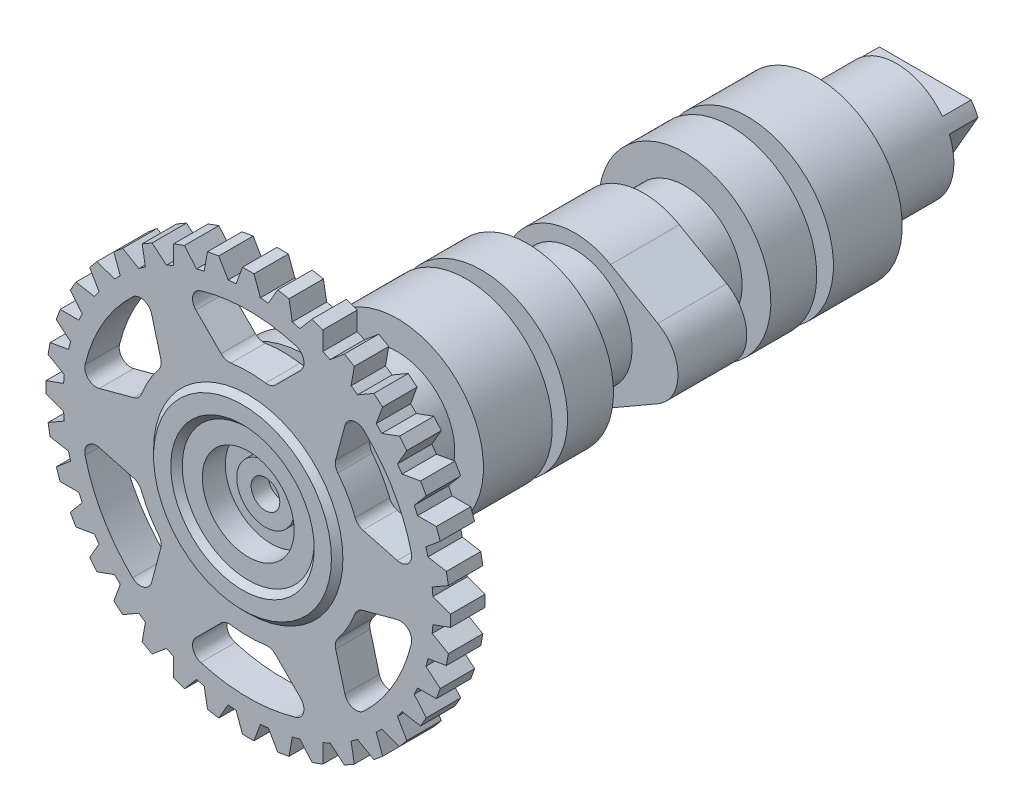
from build123d import *

# Parameters (mm, degrees)
SKETCH1_R               = 10
SHAFT_DEPTH             = 118
SKETCH2_R               = 32.25
GEAR_DEPTH              = 6
BOSS_EXTRUDE3_DEPTH     = 6
SKETCH4_R               = 14
BOSS_EXTRUDE4_DEPTH     = 3
BOSS_EXTRUDE5_START     = 4
SKETCH5_R               = 17.5
BOSS_EXTRUDE5_DEPTH     = 4
CUT_EXTRUDE1_DEPTH      = 129.098106934
CUT_EXTRUDE1_DEPTH_BACK = 5
SKETCH7_R               = 8
CUT_EXTRUDE2_DEPTH      = 3
SKETCH8_R               = 8
SKETCH8_R_2             = 5
CUT_EXTRUDE3_DEPTH      = 1
SKETCH9_R               = 2.5
CUT_EXTRUDE4_DEPTH      = 3
SKETCH10_R              = 15.5
SKETCH10_R_2            = 12.5
BOSS_EXTRUDE6_DEPTH     = 1
CHAMFER1_SIZE           = 1
BOSS_EXTRUDE7_START     = 34.662
BOSS_EXTRUDE7_DEPTH     = 8
BOSS_EXTRUDE8_START     = 70.0933
BOSS_EXTRUDE8_DEPTH     = 8
BOSS_EXTRUDE9_START     = 20
SKETCH13_R              = 15
BOSS_EXTRUDE9_DEPTH     = 12
BOSS_EXTRUDE10_START    = 81
SKETCH14_R              = 15
BOSS_EXTRUDE10_DEPTH    = 12
BOSS_EXTRUDE11_START    = 62.9
BOSS_EXTRUDE11_DEPTH    = 12


with BuildPart() as part:
    # Sketch1 → Shaft (new body)
    with BuildSketch(Plane.XY):
        Circle(SKETCH1_R)
    extrude(amount=SHAFT_DEPTH)

    # Sketch2 → Gear (add)
    with BuildSketch(Plane.XY.offset(118)):
        Circle(SKETCH2_R)
        with BuildLine():
            Line((-4.737426033, 20.333343976), (-9.125903685, 24.721821628))
            ThreePointArc((-9.125903685, 24.721821628), (-9.649890482, 26.629370136), (-8.277685728, 28.054276305))
            ThreePointArc((-8.277685728, 28.054276305), (0, 29.25), (8.277685728, 28.054276305))
            ThreePointArc((8.277685728, 28.054276305), (9.649890482, 26.629370136), (9.125903685, 24.721821628))
            Line((9.125903685, 24.721821628), (4.737426033, 20.333343976))
            ThreePointArc((4.737426033, 20.333343976), (3.946421798, 19.847133866), (3.021102246, 19.770506853))
            ThreePointArc((3.021102246, 19.770506853), (0, 20), (-3.021102246, 19.770506853))
            ThreePointArc((-3.021102246, 19.770506853), (-3.946421798, 19.847133866), (-4.737426033, 20.333343976))
        make_face(mode=Mode.SUBTRACT)
        with BuildLine():
            Line((15.24047941, 14.269403281), (16.846773715, 20.264175238))
            ThreePointArc((16.846773715, 20.264175238), (18.236765784, 21.671735369), (20.156873101, 21.195824278))
            ThreePointArc((20.156873101, 21.195824278), (25.331243061, 14.625), (28.434558829, 6.858452027))
            ThreePointArc((28.434558829, 6.858452027), (27.886656265, 4.957634767), (25.9726774, 4.45764639))
            Line((25.9726774, 4.45764639), (19.977905444, 6.063940694))
            ThreePointArc((19.977905444, 6.063940694), (19.161333019, 6.505865402), (18.632312303, 7.268902134))
            ThreePointArc((18.632312303, 7.268902134), (17.320508076, 10), (15.611210057, 12.501604719))
            ThreePointArc((15.611210057, 12.501604719), (15.214911221, 13.341268464), (15.24047941, 14.269403281))
        make_face(mode=Mode.SUBTRACT)
        with BuildLine():
            Line((19.977905444, -6.063940694), (25.9726774, -4.45764639))
            ThreePointArc((25.9726774, -4.45764639), (27.886656265, -4.957634767), (28.434558829, -6.858452027))
            ThreePointArc((28.434558829, -6.858452027), (25.331243061, -14.625), (20.156873101, -21.195824278))
            ThreePointArc((20.156873101, -21.195824278), (18.236765784, -21.671735369), (16.846773715, -20.264175238))
            Line((16.846773715, -20.264175238), (15.24047941, -14.269403281))
            ThreePointArc((15.24047941, -14.269403281), (15.214911221, -13.341268464), (15.611210057, -12.501604719))
            ThreePointArc((15.611210057, -12.501604719), (17.320508076, -10), (18.632312303, -7.268902134))
            ThreePointArc((18.632312303, -7.268902134), (19.161333019, -6.505865402), (19.977905444, -6.063940694))
        make_face(mode=Mode.SUBTRACT)
        with BuildLine():
            Line((4.737426033, -20.333343976), (9.125903685, -24.721821628))
            ThreePointArc((9.125903685, -24.721821628), (9.649890482, -26.629370136), (8.277685728, -28.054276305))
            ThreePointArc((8.277685728, -28.054276305), (0, -29.25), (-8.277685728, -28.054276305))
            ThreePointArc((-8.277685728, -28.054276305), (-9.649890482, -26.629370136), (-9.125903685, -24.721821628))
            Line((-9.125903685, -24.721821628), (-4.737426033, -20.333343976))
            ThreePointArc((-4.737426033, -20.333343976), (-3.946421798, -19.847133866), (-3.021102246, -19.770506853))
            ThreePointArc((-3.021102246, -19.770506853), (0, -20), (3.021102246, -19.770506853))
            ThreePointArc((3.021102246, -19.770506853), (3.946421798, -19.847133866), (4.737426033, -20.333343976))
        make_face(mode=Mode.SUBTRACT)
        with BuildLine():
            Line((-15.24047941, -14.269403281), (-16.846773715, -20.264175238))
            ThreePointArc((-16.846773715, -20.264175238), (-18.236765784, -21.671735369), (-20.156873101, -21.195824278))
            ThreePointArc((-20.156873101, -21.195824278), (-25.331243061, -14.625), (-28.434558829, -6.858452027))
            ThreePointArc((-28.434558829, -6.858452027), (-27.886656265, -4.957634767), (-25.9726774, -4.45764639))
            Line((-25.9726774, -4.45764639), (-19.977905444, -6.063940694))
            ThreePointArc((-19.977905444, -6.063940694), (-19.161333019, -6.505865402), (-18.632312303, -7.268902134))
            ThreePointArc((-18.632312303, -7.268902134), (-17.320508076, -10), (-15.611210057, -12.501604719))
            ThreePointArc((-15.611210057, -12.501604719), (-15.214911221, -13.341268464), (-15.24047941, -14.269403281))
        make_face(mode=Mode.SUBTRACT)
        with BuildLine():
            Line((-19.977905444, 6.063940694), (-25.9726774, 4.45764639))
            ThreePointArc((-25.9726774, 4.45764639), (-27.886656265, 4.957634767), (-28.434558829, 6.858452027))
            ThreePointArc((-28.434558829, 6.858452027), (-25.331243061, 14.625), (-20.156873101, 21.195824278))
            ThreePointArc((-20.156873101, 21.195824278), (-18.236765784, 21.671735369), (-16.846773715, 20.264175238))
            Line((-16.846773715, 20.264175238), (-15.24047941, 14.269403281))
            ThreePointArc((-15.24047941, 14.269403281), (-15.214911221, 13.341268464), (-15.611210057, 12.501604719))
            ThreePointArc((-15.611210057, 12.501604719), (-17.320508076, 10), (-18.632312303, 7.268902134))
            ThreePointArc((-18.632312303, 7.268902134), (-19.161333019, 6.505865402), (-19.977905444, 6.063940694))
        make_face(mode=Mode.SUBTRACT)
    extrude(amount=-GEAR_DEPTH)

    # Sketch3 → Boss-Extrude3 (add)
    with BuildSketch(Plane.XY.offset(118)):
        with BuildLine():
            Line((-2.117233542, 32.180426071), (-1, 35.25))
            Line((-1, 35.25), (1, 35.25))
            Line((1, 35.25), (2.117233542, 32.180426071))
            ThreePointArc((2.117233542, 32.180426071), (0, 32.25), (-2.117233542, 32.180426071))
        make_face()
        with BuildLine():
            Line((7.105906016, 34.540825116), (7.673140351, 31.323879344))
            ThreePointArc((7.673140351, 31.323879344), (5.60015373, 31.760050035), (3.503004337, 32.059186836))
            Line((3.503004337, 32.059186836), (5.13629051, 34.888121471))
            Line((5.13629051, 34.888121471), (7.105906016, 34.540825116))
        make_face()
        with BuildLine():
            Line((12.995902673, 32.782144739), (12.995902673, 29.515572393))
            ThreePointArc((12.995902673, 29.515572393), (11.030149622, 30.30508702), (9.016805201, 30.963845432))
            Line((9.016805201, 30.963845432), (11.116517431, 33.466185026))
            Line((11.116517431, 33.466185026), (12.995902673, 32.782144739))
        make_face()
        with BuildLine():
            Line((18.491025404, 30.027395483), (17.923791069, 26.810449711))
            ThreePointArc((17.923791069, 26.810449711), (16.125, 27.929319272), (14.256635003, 28.927683253))
            Line((14.256635003, 28.927683253), (16.758974596, 31.027395483))
            Line((16.758974596, 31.027395483), (18.491025404, 30.027395483))
        make_face()
        with BuildLine():
            Line((23.424307685, 26.36027901), (22.307074143, 23.290705082))
            ThreePointArc((22.307074143, 23.290705082), (20.729900412, 24.704933291), (19.063284163, 26.012568057))
            Line((19.063284163, 26.012568057), (21.892218798, 27.64585423))
            Line((21.892218798, 27.64585423), (23.424307685, 26.36027901))
        make_face()
        with BuildLine():
            Line((27.64585423, 21.892218798), (26.012568057, 19.063284163))
            ThreePointArc((26.012568057, 19.063284163), (24.704933291, 20.729900412), (23.290705082, 22.307074143))
            Line((23.290705082, 22.307074143), (26.36027901, 23.424307685))
            Line((26.36027901, 23.424307685), (27.64585423, 21.892218798))
        make_face()
        with BuildLine():
            Line((31.027395483, 16.758974596), (28.927683253, 14.256635003))
            ThreePointArc((28.927683253, 14.256635003), (27.929319272, 16.125), (26.810449711, 17.923791069))
            Line((26.810449711, 17.923791069), (30.027395483, 18.491025404))
            Line((30.027395483, 18.491025404), (31.027395483, 16.758974596))
        make_face()
        with BuildLine():
            Line((33.466185026, 11.116517431), (30.963845432, 9.016805201))
            ThreePointArc((30.963845432, 9.016805201), (30.30508702, 11.030149622), (29.515572393, 12.995902673))
            Line((29.515572393, 12.995902673), (32.782144739, 12.995902673))
            Line((32.782144739, 12.995902673), (33.466185026, 11.116517431))
        make_face()
        with BuildLine():
            Line((34.888121471, 5.13629051), (32.059186836, 3.503004337))
            ThreePointArc((32.059186836, 3.503004337), (31.760050035, 5.60015373), (31.323879344, 7.673140351))
            Line((31.323879344, 7.673140351), (34.540825116, 7.105906016))
            Line((34.540825116, 7.105906016), (34.888121471, 5.13629051))
        make_face()
        with BuildLine():
            Line((35.25, -1), (32.180426071, -2.117233542))
            ThreePointArc((32.180426071, -2.117233542), (32.25, 0), (32.180426071, 2.117233542))
            Line((32.180426071, 2.117233542), (35.25, 1))
            Line((35.25, 1), (35.25, -1))
        make_face()
        with BuildLine():
            Line((34.540825116, -7.105906016), (31.323879344, -7.673140351))
            ThreePointArc((31.323879344, -7.673140351), (31.760050035, -5.60015373), (32.059186836, -3.503004337))
            Line((32.059186836, -3.503004337), (34.888121471, -5.13629051))
            Line((34.888121471, -5.13629051), (34.540825116, -7.105906016))
        make_face()
        with BuildLine():
            Line((32.782144739, -12.995902673), (29.515572393, -12.995902673))
            ThreePointArc((29.515572393, -12.995902673), (30.30508702, -11.030149622), (30.963845432, -9.016805201))
            Line((30.963845432, -9.016805201), (33.466185026, -11.116517431))
            Line((33.466185026, -11.116517431), (32.782144739, -12.995902673))
        make_face()
        with BuildLine():
            Line((30.027395483, -18.491025404), (26.810449711, -17.923791069))
            ThreePointArc((26.810449711, -17.923791069), (27.929319272, -16.125), (28.927683253, -14.256635003))
            Line((28.927683253, -14.256635003), (31.027395483, -16.758974596))
            Line((31.027395483, -16.758974596), (30.027395483, -18.491025404))
        make_face()
        with BuildLine():
            Line((26.36027901, -23.424307685), (23.290705082, -22.307074143))
            ThreePointArc((23.290705082, -22.307074143), (24.704933291, -20.729900412), (26.012568057, -19.063284163))
            Line((26.012568057, -19.063284163), (27.64585423, -21.892218798))
            Line((27.64585423, -21.892218798), (26.36027901, -23.424307685))
        make_face()
        with BuildLine():
            Line((21.892218798, -27.64585423), (19.063284163, -26.012568057))
            ThreePointArc((19.063284163, -26.012568057), (20.729900412, -24.704933291), (22.307074143, -23.290705082))
            Line((22.307074143, -23.290705082), (23.424307685, -26.36027901))
            Line((23.424307685, -26.36027901), (21.892218798, -27.64585423))
        make_face()
        with BuildLine():
            Line((16.758974596, -31.027395483), (14.256635003, -28.927683253))
            ThreePointArc((14.256635003, -28.927683253), (16.125, -27.929319272), (17.923791069, -26.810449711))
            Line((17.923791069, -26.810449711), (18.491025404, -30.027395483))
            Line((18.491025404, -30.027395483), (16.758974596, -31.027395483))
        make_face()
        with BuildLine():
            Line((11.116517431, -33.466185026), (9.016805201, -30.963845432))
            ThreePointArc((9.016805201, -30.963845432), (11.030149622, -30.30508702), (12.995902673, -29.515572393))
            Line((12.995902673, -29.515572393), (12.995902673, -32.782144739))
            Line((12.995902673, -32.782144739), (11.116517431, -33.466185026))
        make_face()
        with BuildLine():
            Line((5.13629051, -34.888121471), (3.503004337, -32.059186836))
            ThreePointArc((3.503004337, -32.059186836), (5.60015373, -31.760050035), (7.673140351, -31.323879344))
            Line((7.673140351, -31.323879344), (7.105906016, -34.540825116))
            Line((7.105906016, -34.540825116), (5.13629051, -34.888121471))
        make_face()
        with BuildLine():
            Line((-1, -35.25), (-2.117233542, -32.180426071))
            ThreePointArc((-2.117233542, -32.180426071), (0, -32.25), (2.117233542, -32.180426071))
            Line((2.117233542, -32.180426071), (1, -35.25))
            Line((1, -35.25), (-1, -35.25))
        make_face()
        with BuildLine():
            Line((-7.105906016, -34.540825116), (-7.673140351, -31.323879344))
            ThreePointArc((-7.673140351, -31.323879344), (-5.60015373, -31.760050035), (-3.503004337, -32.059186836))
            Line((-3.503004337, -32.059186836), (-5.13629051, -34.888121471))
            Line((-5.13629051, -34.888121471), (-7.105906016, -34.540825116))
        make_face()
        with BuildLine():
            Line((-12.995902673, -32.782144739), (-12.995902673, -29.515572393))
            ThreePointArc((-12.995902673, -29.515572393), (-11.030149622, -30.30508702), (-9.016805201, -30.963845432))
            Line((-9.016805201, -30.963845432), (-11.116517431, -33.466185026))
            Line((-11.116517431, -33.466185026), (-12.995902673, -32.782144739))
        make_face()
        with BuildLine():
            Line((-18.491025404, -30.027395483), (-17.923791069, -26.810449711))
            ThreePointArc((-17.923791069, -26.810449711), (-16.125, -27.929319272), (-14.256635003, -28.927683253))
            Line((-14.256635003, -28.927683253), (-16.758974596, -31.027395483))
            Line((-16.758974596, -31.027395483), (-18.491025404, -30.027395483))
        make_face()
        with BuildLine():
            Line((-23.424307685, -26.36027901), (-22.307074143, -23.290705082))
            ThreePointArc((-22.307074143, -23.290705082), (-20.729900412, -24.704933291), (-19.063284163, -26.012568057))
            Line((-19.063284163, -26.012568057), (-21.892218798, -27.64585423))
            Line((-21.892218798, -27.64585423), (-23.424307685, -26.36027901))
        make_face()
        with BuildLine():
            Line((-27.64585423, -21.892218798), (-26.012568057, -19.063284163))
            ThreePointArc((-26.012568057, -19.063284163), (-24.704933291, -20.729900412), (-23.290705082, -22.307074143))
            Line((-23.290705082, -22.307074143), (-26.36027901, -23.424307685))
            Line((-26.36027901, -23.424307685), (-27.64585423, -21.892218798))
        make_face()
        with BuildLine():
            Line((-31.027395483, -16.758974596), (-28.927683253, -14.256635003))
            ThreePointArc((-28.927683253, -14.256635003), (-27.929319272, -16.125), (-26.810449711, -17.923791069))
            Line((-26.810449711, -17.923791069), (-30.027395483, -18.491025404))
            Line((-30.027395483, -18.491025404), (-31.027395483, -16.758974596))
        make_face()
        with BuildLine():
            Line((-33.466185026, -11.116517431), (-30.963845432, -9.016805201))
            ThreePointArc((-30.963845432, -9.016805201), (-30.30508702, -11.030149622), (-29.515572393, -12.995902673))
            Line((-29.515572393, -12.995902673), (-32.782144739, -12.995902673))
            Line((-32.782144739, -12.995902673), (-33.466185026, -11.116517431))
        make_face()
        with BuildLine():
            Line((-34.888121471, -5.13629051), (-32.059186836, -3.503004337))
            ThreePointArc((-32.059186836, -3.503004337), (-31.760050035, -5.60015373), (-31.323879344, -7.673140351))
            Line((-31.323879344, -7.673140351), (-34.540825116, -7.105906016))
            Line((-34.540825116, -7.105906016), (-34.888121471, -5.13629051))
        make_face()
        with BuildLine():
            Line((-35.25, 1), (-32.180426071, 2.117233542))
            ThreePointArc((-32.180426071, 2.117233542), (-32.25, 0), (-32.180426071, -2.117233542))
            Line((-32.180426071, -2.117233542), (-35.25, -1))
            Line((-35.25, -1), (-35.25, 1))
        make_face()
        with BuildLine():
            Line((-34.540825116, 7.105906016), (-31.323879344, 7.673140351))
            ThreePointArc((-31.323879344, 7.673140351), (-31.760050035, 5.60015373), (-32.059186836, 3.503004337))
            Line((-32.059186836, 3.503004337), (-34.888121471, 5.13629051))
            Line((-34.888121471, 5.13629051), (-34.540825116, 7.105906016))
        make_face()
        with BuildLine():
            Line((-32.782144739, 12.995902673), (-29.515572393, 12.995902673))
            ThreePointArc((-29.515572393, 12.995902673), (-30.30508702, 11.030149622), (-30.963845432, 9.016805201))
            Line((-30.963845432, 9.016805201), (-33.466185026, 11.116517431))
            Line((-33.466185026, 11.116517431), (-32.782144739, 12.995902673))
        make_face()
        with BuildLine():
            Line((-30.027395483, 18.491025404), (-26.810449711, 17.923791069))
            ThreePointArc((-26.810449711, 17.923791069), (-27.929319272, 16.125), (-28.927683253, 14.256635003))
            Line((-28.927683253, 14.256635003), (-31.027395483, 16.758974596))
            Line((-31.027395483, 16.758974596), (-30.027395483, 18.491025404))
        make_face()
        with BuildLine():
            Line((-26.36027901, 23.424307685), (-23.290705082, 22.307074143))
            ThreePointArc((-23.290705082, 22.307074143), (-24.704933291, 20.729900412), (-26.012568057, 19.063284163))
            Line((-26.012568057, 19.063284163), (-27.64585423, 21.892218798))
            Line((-27.64585423, 21.892218798), (-26.36027901, 23.424307685))
        make_face()
        with BuildLine():
            Line((-21.892218798, 27.64585423), (-19.063284163, 26.012568057))
            ThreePointArc((-19.063284163, 26.012568057), (-20.729900412, 24.704933291), (-22.307074143, 23.290705082))
            Line((-22.307074143, 23.290705082), (-23.424307685, 26.36027901))
            Line((-23.424307685, 26.36027901), (-21.892218798, 27.64585423))
        make_face()
        with BuildLine():
            Line((-16.758974596, 31.027395483), (-14.256635003, 28.927683253))
            ThreePointArc((-14.256635003, 28.927683253), (-16.125, 27.929319272), (-17.923791069, 26.810449711))
            Line((-17.923791069, 26.810449711), (-18.491025404, 30.027395483))
            Line((-18.491025404, 30.027395483), (-16.758974596, 31.027395483))
        make_face()
        with BuildLine():
            Line((-11.116517431, 33.466185026), (-9.016805201, 30.963845432))
            ThreePointArc((-9.016805201, 30.963845432), (-11.030149622, 30.30508702), (-12.995902673, 29.515572393))
            Line((-12.995902673, 29.515572393), (-12.995902673, 32.782144739))
            Line((-12.995902673, 32.782144739), (-11.116517431, 33.466185026))
        make_face()
        with BuildLine():
            Line((-5.13629051, 34.888121471), (-3.503004337, 32.059186836))
            ThreePointArc((-3.503004337, 32.059186836), (-5.60015373, 31.760050035), (-7.673140351, 31.323879344))
            Line((-7.673140351, 31.323879344), (-7.105906016, 34.540825116))
            Line((-7.105906016, 34.540825116), (-5.13629051, 34.888121471))
        make_face()
    extrude(amount=-BOSS_EXTRUDE3_DEPTH)

    # Sketch4 → Boss-Extrude4 (add)
    with BuildSketch(Plane(origin=(0, 0, 112), x_dir=(-1, 0, 0), z_dir=(0, 0, -1))):
        with Locations(Location((0, 0, 0), (0, 0, 180))):
            Circle(SKETCH4_R)
    extrude(amount=BOSS_EXTRUDE4_DEPTH)

    # Sketch5 → Boss-Extrude5 (add)
    with BuildSketch(Plane(origin=(0, 0, 112), x_dir=(-1, 0, 0), z_dir=(0, 0, -1)).offset(BOSS_EXTRUDE5_START)):
        Circle(SKETCH5_R)
    extrude(amount=BOSS_EXTRUDE5_DEPTH)

    # Sketch6 → Cut-Extrude1 (cut, two sides: drawn at the far end of the back side and taken through both)
    with BuildSketch(Plane(origin=(0, 0, 0), x_dir=(-1, 0, 0), z_dir=(0, 0, -1)).offset(-CUT_EXTRUDE1_DEPTH_BACK)):
        with BuildLine():
            Line((-1.196152423, -9.92820323), (-9.196152423, 3.92820323))
            ThreePointArc((-9.196152423, 3.92820323), (-8.660254038, -5), (-1.196152423, -9.92820323))
        make_face()
        with BuildLine():
            Line((-8, 6), (8, 6))
            ThreePointArc((8, 6), (0, 10), (-8, 6))
        make_face()
        with BuildLine():
            Line((9.196152423, 3.92820323), (1.196152423, -9.92820323))
            ThreePointArc((1.196152423, -9.92820323), (8.660254038, -5), (9.196152423, 3.92820323))
        make_face()
    extrude(amount=CUT_EXTRUDE1_DEPTH + CUT_EXTRUDE1_DEPTH_BACK, mode=Mode.SUBTRACT)

    # Sketch7 → Cut-Extrude2 (cut)
    with BuildSketch(Plane.XY.offset(118)):
        Circle(SKETCH7_R)
    extrude(amount=-CUT_EXTRUDE2_DEPTH, mode=Mode.SUBTRACT)

    # Sketch8 → Cut-Extrude3 (cut)
    with BuildSketch(Plane.XY.offset(115)):
        Circle(SKETCH8_R)
        Circle(SKETCH8_R_2, mode=Mode.SUBTRACT)
    extrude(amount=-CUT_EXTRUDE3_DEPTH, mode=Mode.SUBTRACT)

    # Sketch9 → Cut-Extrude4 (cut)
    with BuildSketch(Plane.XY.offset(115)):
        Circle(SKETCH9_R)
    extrude(amount=-CUT_EXTRUDE4_DEPTH, mode=Mode.SUBTRACT)

    # Sketch10 → Boss-Extrude6 (add)
    with BuildSketch(Plane.XY.offset(118)):
        Circle(SKETCH10_R)
        Circle(SKETCH10_R_2, mode=Mode.SUBTRACT)
    extrude(amount=BOSS_EXTRUDE6_DEPTH)

    # Chamfer1
    chamfer1_edges = [part.edges().sort_by_distance(p)[0] for p in [
        (-12.5, 0, 118),
        (-15.5, 0, 118),
    ]]
    chamfer(chamfer1_edges, length=CHAMFER1_SIZE - 0.0001)  # a hair under: the kernel refuses the full size

    # Sketch11 → Boss-Extrude7 (add)
    with BuildSketch(Plane(origin=(0, 0, 112), x_dir=(-1, 0, 0), z_dir=(0, 0, -1)).offset(BOSS_EXTRUDE7_START)):
        with BuildLine():
            Line((-4.490865188, -14.311957583), (5.961110826, -17.591621805))
            ThreePointArc((5.961110826, -17.591621805), (13.498539803, -16.086933305), (16.28922951, -8.925301226))
            Line((16.28922951, -8.925301226), (14.874357345, 1.937393502))
            ThreePointArc((14.874357345, 1.937393502), (-9.641814145, 11.490666647), (-4.490865188, -14.311957583))
        make_face()
    extrude(amount=BOSS_EXTRUDE7_DEPTH)

    # Sketch12 → Boss-Extrude8 (add)
    with BuildSketch(Plane(origin=(0, 0, 112), x_dir=(-1, 0, 0), z_dir=(0, 0, -1)).offset(BOSS_EXTRUDE8_START)):
        with BuildLine():
            Line((-4.490865188, -14.311957583), (5.961110826, -17.591621805))
            ThreePointArc((5.961110826, -17.591621805), (13.498539803, -16.086933305), (16.28922951, -8.925301226))
            Line((16.28922951, -8.925301226), (14.874357345, 1.937393502))
            ThreePointArc((14.874357345, 1.937393502), (-9.641814145, 11.490666647), (-4.490865188, -14.311957583))
        make_face()
    extrude(amount=BOSS_EXTRUDE8_DEPTH)

    # Sketch13 → Boss-Extrude9 (add)
    with BuildSketch(Plane(origin=(0, 0, 112), x_dir=(-1, 0, 0), z_dir=(0, 0, -1)).offset(BOSS_EXTRUDE9_START)):
        Circle(SKETCH13_R)
    extrude(amount=BOSS_EXTRUDE9_DEPTH)

    # Sketch14 → Boss-Extrude10 (add)
    with BuildSketch(Plane(origin=(0, 0, 112), x_dir=(-1, 0, 0), z_dir=(0, 0, -1)).offset(BOSS_EXTRUDE10_START)):
        Circle(SKETCH14_R)
    extrude(amount=BOSS_EXTRUDE10_DEPTH)

    # Sketch15 → Boss-Extrude11 (add)
    with BuildSketch(Plane(origin=(0, 0, 112), x_dir=(-1, 0, 0), z_dir=(0, 0, -1)).offset(BOSS_EXTRUDE11_START)):
        with BuildLine():
            Line((-6.25, 10.825317547), (-14.5, 6.062177826))
            ThreePointArc((-14.5, 6.062177826), (-18, 0), (-14.5, -6.062177826))
            Line((-14.5, -6.062177826), (-6.25, -10.825317547))
            ThreePointArc((-6.25, -10.825317547), (12.5, 0), (-6.25, 10.825317547))
        make_face()
    extrude(amount=-BOSS_EXTRUDE11_DEPTH)


solid = part.part
